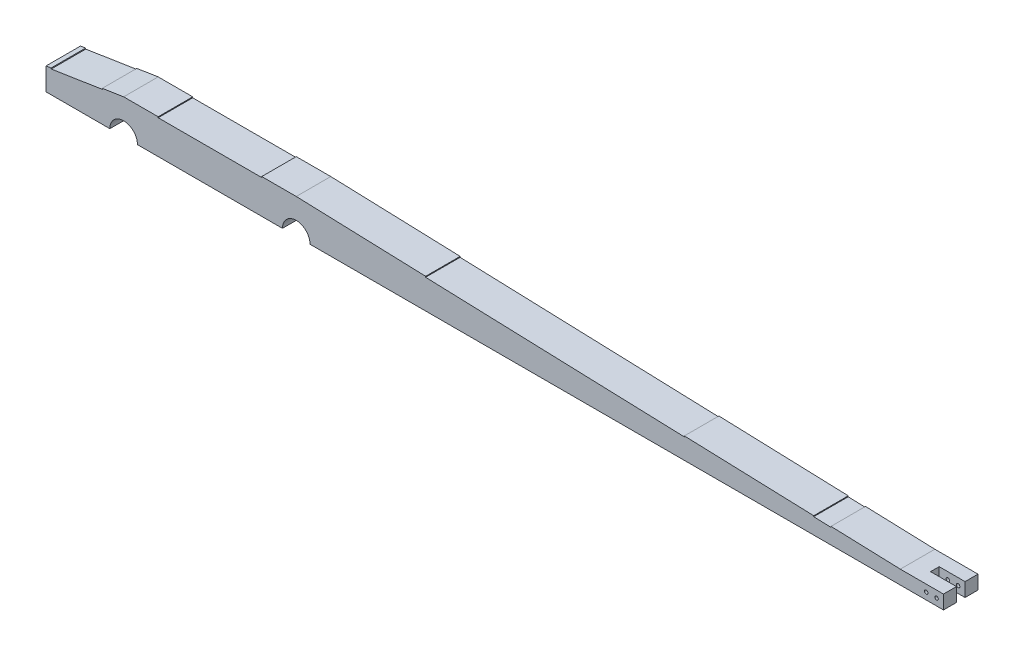
from build123d import *

# Parameters (mm, degrees)
BOSS_EXTRUDE1_DEPTH = 20
SKETCH2_W           = 150
SKETCH2_H           = 20
SKETCH2_W_2         = 10
ROPEGROOVE1_DEPTH   = 0.5
SKETCH4_W           = 60
SKETCH4_H           = 20
ROPEGROOVE2_DEPTH   = 0.5
SKETCH5_W           = 30
SKETCH5_H           = 20
ROPEGROOVE3_DEPTH   = 0.5
SKETCH6_W           = 15
SKETCH6_H           = 5
CUT_EXTRUDE1_DEPTH  = 376.724633209
SKETCH7_R           = 1
CUT_EXTRUDE2_DEPTH  = 377.065153929


with BuildPart() as part:
    # Sketch1 → Boss-Extrude1 (new body)
    with BuildSketch(Plane.XY):
        with BuildLine():
            Line((-8, 0), (-92, 0))
            ThreePointArc((-92, 0), (-100, 8), (-108, 0))
            Line((-108, 0), (-145, 0))
            Line((-145, 0), (-145, 13))
            Line((-145, 13), (-100, 20))
            Line((-100, 20), (0, 20))
            Line((0, 20), (350, 8))
            Line((350, 8), (375, 8))
            Line((375, 8), (375, 0))
            Line((375, 0), (8, 0))
            ThreePointArc((8, 0), (0, 8), (-8, 0))
        make_face()
    extrude(amount=BOSS_EXTRUDE1_DEPTH)

    # Sketch2 → RopeGroove1 (cut)
    with BuildSketch(Plane(origin=(0.684909168, 19.9765174, 0), x_dir=(0.9994127625749618, -0.03426558043114153, 0), z_dir=(0.034265580431141536, 0.9994127625749619, 0))):
        with Locations((149.314688391, -10)):
            Rectangle(SKETCH2_W, SKETCH2_H)
        with Locations((304.314688391, -10)):
            Rectangle(SKETCH2_W_2, SKETCH2_H)
    extrude(amount=-ROPEGROOVE1_DEPTH, mode=Mode.SUBTRACT)

    # Sketch4 → RopeGroove2 (cut)
    with BuildSketch(Plane(origin=(0, 20, 0), x_dir=(1, 0, 0), z_dir=(0, 1, 0))):
        with Locations((-50, -10)):
            Rectangle(SKETCH4_W, SKETCH4_H)
    extrude(amount=-ROPEGROOVE2_DEPTH, mode=Mode.SUBTRACT)

    # Sketch5 → RopeGroove3 (cut)
    with BuildSketch(Plane(origin=(-5.400192864, 34.715525554, 0), x_dir=(0.9881164689548824, 0.15370700628187053, 0), z_dir=(-0.15370700628187053, 0.9881164689548824, 0))):
        with Locations((-123.278696917, -10)):
            Rectangle(SKETCH5_W, SKETCH5_H)
    extrude(amount=-ROPEGROOVE3_DEPTH, mode=Mode.SUBTRACT)

    # Sketch6 → Cut-Extrude1 (cut, through all)
    with BuildSketch(Plane(origin=(0, 8, 0), x_dir=(1, 0, 0), z_dir=(0, 1, 0))):
        with Locations((367.5, -10)):
            Rectangle(SKETCH6_W, SKETCH6_H)
    extrude(amount=-CUT_EXTRUDE1_DEPTH, mode=Mode.SUBTRACT)

    # Sketch7 → Cut-Extrude2 (cut, through all)
    with BuildSketch(Plane.XY.offset(20)):
        with Locations((371, 4)):
            Circle(SKETCH7_R)
        with Locations((365, 4)):
            Circle(SKETCH7_R)
    extrude(amount=-CUT_EXTRUDE2_DEPTH, mode=Mode.SUBTRACT)


solid = part.part
